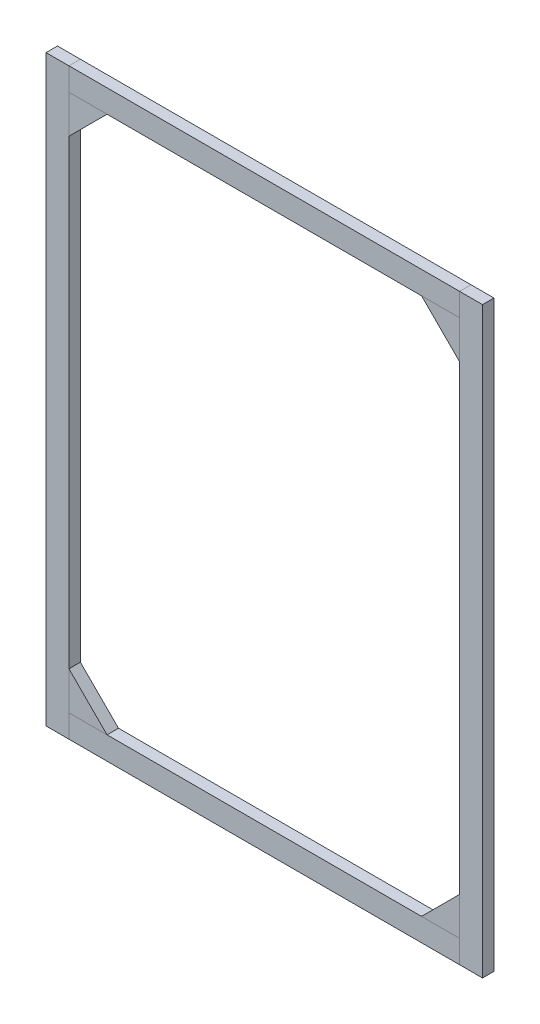
from build123d import *

# Parameters (mm, degrees)
MEMBER_START                 = -765
MEMBER_20_X_20_1_OUTLINE_W   = 60
MEMBER_20_X_20_1_OUTLINE_H   = 30
MEMBER_20_X_20_1_DEPTH       = 1530
MEMBER_20_X_20_1_2_OUTLINE_W = 1025
MEMBER_20_X_20_1_2_OUTLINE_H = 30
MEMBER_20_X_20_1_2_DEPTH     = 60
MEMBER_START_2               = 705
MEMBER_20_X_20_1_3_OUTLINE_W = 1025
MEMBER_20_X_20_1_3_OUTLINE_H = 30
MEMBER_20_X_20_1_3_DEPTH     = 60
GUSSET_1_THICKNESS           = 30


# Read off the part's stored shape, not the designer's step: Квадрат 20 X 20(1)
with BuildPart() as part:
    # Member 20 X 20_1 outline → Member 20 X 20_1 (new body)
    with BuildSketch(Plane(origin=(0, 0, 0), x_dir=(1, 0, 0), z_dir=(0, 1, 0)).offset(MEMBER_START)):
        with Locations((542.5, 0)):
            Rectangle(MEMBER_20_X_20_1_OUTLINE_W, MEMBER_20_X_20_1_OUTLINE_H)
        with Locations((-542.5, 0)):
            Rectangle(MEMBER_20_X_20_1_OUTLINE_W, MEMBER_20_X_20_1_OUTLINE_H)
    extrude(amount=MEMBER_20_X_20_1_DEPTH)


with BuildPart() as body_2:
    # Member 20 X 20_1 2 outline → Member 20 X 20_1 2 (new body)
    with BuildSketch(Plane(origin=(0, 0, 0), x_dir=(1, 0, 0), z_dir=(0, 1, 0)).offset(MEMBER_START)):
        Rectangle(MEMBER_20_X_20_1_2_OUTLINE_W, MEMBER_20_X_20_1_2_OUTLINE_H)
    extrude(amount=MEMBER_20_X_20_1_2_DEPTH)


with BuildPart() as body_3:
    # Member 20 X 20_1 3 outline → Member 20 X 20_1 3 (new body)
    with BuildSketch(Plane(origin=(0, 0, 0), x_dir=(1, 0, 0), z_dir=(0, 1, 0)).offset(MEMBER_START_2)):
        Rectangle(MEMBER_20_X_20_1_3_OUTLINE_W, MEMBER_20_X_20_1_3_OUTLINE_H)
    extrude(amount=MEMBER_20_X_20_1_3_DEPTH)


with BuildPart() as body_4:
    # Gusset 1: a gusset: a plate 30.0 thick in the corner of two members, its outline drawn in place
    gusset_1_outline = Wire([Line((-512.5, 705, -15), (-412.5, 705, -15)), Line((-412.5, 705, -15), (-512.5, 605, -15)), Line((-512.5, 605, -15), (-512.5, 705, -15))])
    add(extrude(Face(gusset_1_outline), amount=GUSSET_1_THICKNESS, dir=(0, 0, 1)))


with BuildPart() as body_5:
    # Зеркальное отражение2: mirrored copy
    add(body_4.part.mirror(Plane(origin=(0, 0, 0), x_dir=(0, 0, 1), z_dir=(1, 0, 0))))


with BuildPart() as body_6:
    # Зеркальное отражение3: mirrored copy
    add(body_4.part.mirror(Plane.ZX))


with BuildPart() as body_7:
    # Mirror 3 2: mirrored copy
    add(body_5.part.mirror(Plane.ZX))


solid = Compound([part.part, body_2.part, body_3.part, body_4.part, body_5.part, body_6.part, body_7.part])
